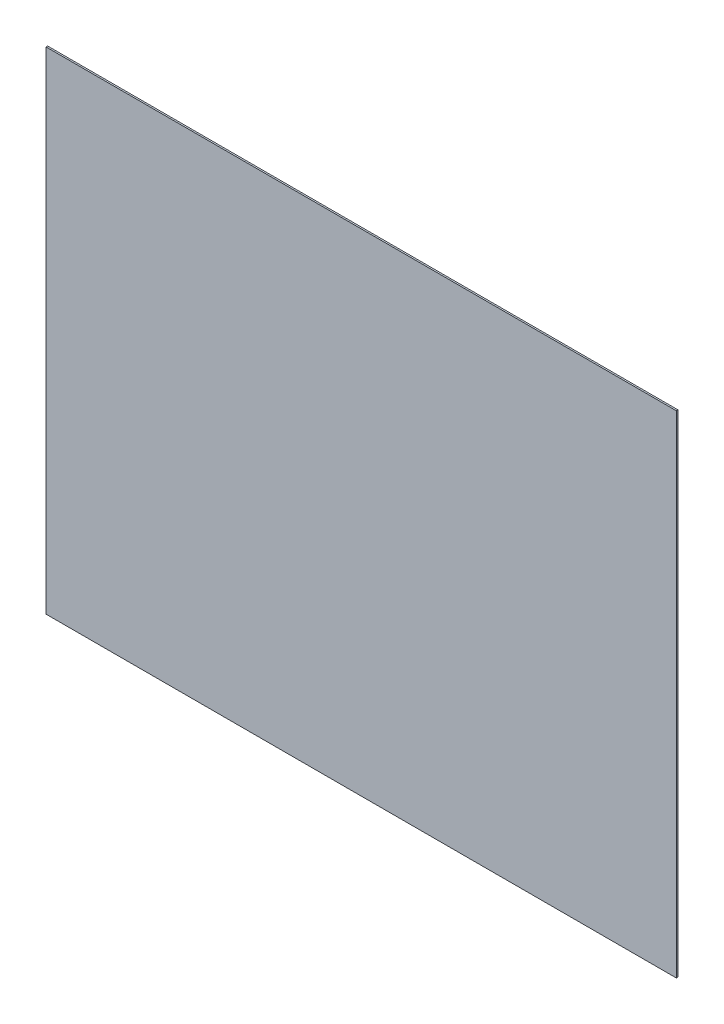
from build123d import *

# Parameters (mm, degrees)
BOSS_EXTRUDE1_DEPTH = 1.5875


with BuildPart() as part:
    # Sketch2 → Boss-Extrude1 (new body)
    with BuildSketch(Plane.XY):
        Polygon((-157.563975735, 102.422839677), (-157.513115647, -381.828157653), (463.745480927, -381.762907881), (463.694620838, 102.488089449), align=None)
    extrude(amount=BOSS_EXTRUDE1_DEPTH)


solid = part.part
